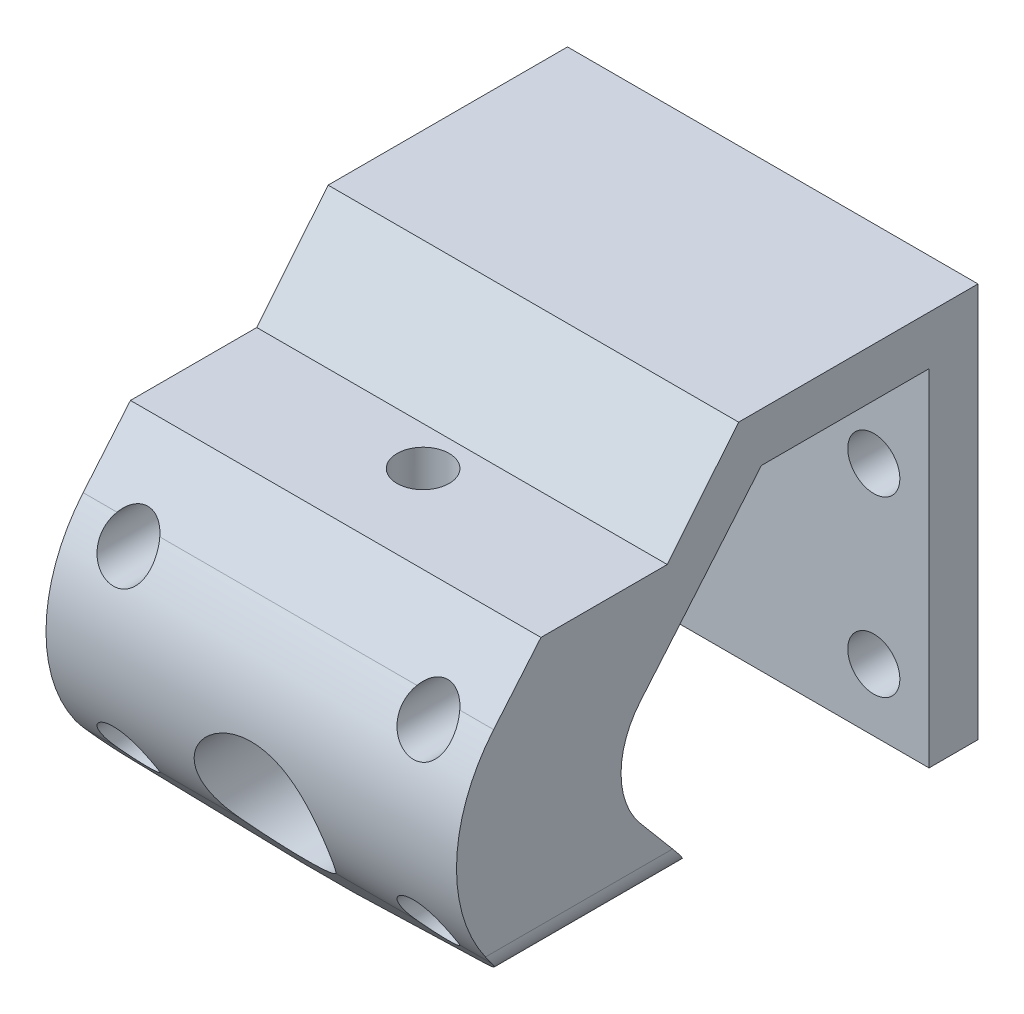
from build123d import *
from OCP.BRepFilletAPI import BRepFilletAPI_MakeChamfer

# Parameters (mm, degrees)
EXTRUDE_1_DEPTH     = 26
SKETCH_2_R          = 1.65
CUT_EXTRUDE_1_DEPTH = 45.819078563
SKETCH_3_W          = 28.1444964
SKETCH_3_H          = 6.1
CUT_EXTRUDE_2_DEPTH = 35.940261345
CUT_EXTRUDE_4_REACH = 46.819
SKETCH_5_R          = 4.1
SKETCH_6_R          = 1.65
CUT_EXTRUDE_5_DEPTH = 41.050210522
CHAMFER_1_SIZE      = 2
CHAMFER_1_SIZE2     = 11.342563639
FILLET_1_R          = 2


with BuildPart() as part:
    # 草图1 → 凸台-拉伸1 (new body)
    with BuildSketch(Plane(origin=(0, 0, 0), x_dir=(0, 0, -1), z_dir=(1, 0, 0))):
        with BuildLine():
            Line((17.407451211, 15.55), (2.245544981, 15.55))
            Line((2.245544981, 15.55), (-2.273793452, 10))
            Line((-2.273793452, 10), (-10.273793452, 10))
            Line((-10.273793452, 10), (-13.270509165, 6.44212097))
            ThreePointArc((-13.270509165, 6.44212097), (-15.622040206, 0), (-13.270509165, -6.44212097))
            Line((-13.270509165, -6.44212097), (-10.273793452, -10))
            Line((-10.273793452, -10), (-2.273793452, -10))
            Line((-2.273793452, -10), (2.245544981, -15.55))
            Line((2.245544981, -15.55), (17.407451211, -15.55))
            Line((17.407451211, -15.55), (17.407451211, 15.55))
        make_face()
        with BuildLine():
            Line((3.687588487, 12.45), (14.307451211, 12.45))
            Line((14.307451211, 12.45), (14.307451211, -12.45))
            Line((14.307451211, -12.45), (3.687588487, -12.45))
            Line((3.687588487, -12.45), (-3.977203858, -3.349902904))
            ThreePointArc((-3.977203858, -3.349902904), (-5.2, 0), (-3.977203858, 3.349902904))
            Line((-3.977203858, 3.349902904), (3.687588487, 12.45))
        make_face(mode=Mode.SUBTRACT)
    extrude(amount=EXTRUDE_1_DEPTH)

    # 草图2 → 切除-拉伸1 (cut, through all)
    with BuildSketch(Plane(origin=(0, 0, -17.407451211), x_dir=(-1, 0, 0), z_dir=(0, 0, -1))):
        with Locations((-22.5, 5.5)):
            Circle(SKETCH_2_R)
        with Locations(Location((-22.5, -5.5, 0), (0, 0, 325.181239638))):
            Circle(SKETCH_2_R)
        with Locations(Location((-3.5, -5.5, 0), (0, 0, 325.181239638))):
            Circle(SKETCH_2_R)
        with Locations(Location((-3.5, 5.5, 0), (0, 0, 180))):
            Circle(SKETCH_2_R)
    extrude(amount=-CUT_EXTRUDE_1_DEPTH, mode=Mode.SUBTRACT)

    # 草图3 → 切除-拉伸2 (cut, through all)
    with BuildSketch(Plane.ZY):
        with Locations((-3.335203011, -12.5)):
            Rectangle(SKETCH_3_W, SKETCH_3_H)
    extrude(amount=-CUT_EXTRUDE_2_DEPTH, mode=Mode.SUBTRACT)

    # 草图5 → 切除-拉伸4 (cut, up to next)
    with BuildSketch(Plane.XY.offset(15.622040206), mode=Mode.PRIVATE) as cut_extrude_4_sk1:
        with Locations(Location((13, -3.65, 0), (0, 0, 4.197484636))):
            Circle(SKETCH_5_R)
    cut_extrude_4_tool1 = extrude(cut_extrude_4_sk1.sketch, amount=-CUT_EXTRUDE_4_REACH, mode=Mode.PRIVATE) & part.part
    add(cut_extrude_4_tool1.solids().sort_by_distance((13, -3.65, 15.62204))[0], mode=Mode.SUBTRACT)

    # 草图6 → 切除-拉伸5 (cut, through all)
    with BuildSketch(Plane.XZ.offset(9.45)):
        with Locations(Location((13, 4.737045189, 0), (0, 0, 270))):
            Circle(SKETCH_6_R)
    extrude(amount=-CUT_EXTRUDE_5_DEPTH, mode=Mode.SUBTRACT)

    # 倒角1: one chamfer whose edges measure the first distance from different faces: ONE call of the kernel's chamfer builder (chamfer() names one face for all edges)
    chamfer_1_edges_1 = [part.edges().sort_by_distance(p)[0] for p in [
        (0, -9.45, 4.78814218),
    ]]
    chamfer_1_side_1 = [part.faces().sort_by_distance(p)[0] for p in [
        (0, -9.035760057, -15.857451211),
    ]]
    chamfer_1_edges_2 = [part.edges().sort_by_distance(p)[0] for p in [
        (26, -9.45, 4.78814218),
    ]]
    chamfer_1_side_2 = [part.faces().sort_by_distance(p)[0] for p in [
        (26, -9.035760057, -15.857451211),
    ]]
    chamfer_1 = BRepFilletAPI_MakeChamfer(part.part.solid().wrapped)
    for e in chamfer_1_edges_1:
        chamfer_1.Add(CHAMFER_1_SIZE, CHAMFER_1_SIZE2, e.wrapped, chamfer_1_side_1[0].wrapped)  # the first distance lies on this face
    for e in chamfer_1_edges_2:
        chamfer_1.Add(CHAMFER_1_SIZE, CHAMFER_1_SIZE2, e.wrapped, chamfer_1_side_2[0].wrapped)  # the first distance lies on this face
    add(Compound.cast(chamfer_1.Shape()), mode=Mode.REPLACE)

    # 圆角1
    # the kernel refuses this fillet: 2 mm, written as the material it takes off along each edge
    with BuildSketch(Plane(origin=(26, -7.45, -3.671707212), x_dir=(-0.9848077530122086, -0.17364817766692747, 0), z_dir=(0, 0, 1))) as fillet_1_piece_1:
        with BuildLine():
            CenterArc((FILLET_1_R * 0.839099631177, -FILLET_1_R), FILLET_1_R, 90, 80)
            Line((-FILLET_1_R * 0.145708121835, -FILLET_1_R * 0.826351822333), (0, 0))
            Line((0, 0), (FILLET_1_R * 0.839099631177, 0))
        make_face()
    extrude(amount=20.288802329, mode=Mode.SUBTRACT)
    with BuildSketch(Plane(origin=(0, -7.45, 16.617095117), x_dir=(0, 1, 0), z_dir=(0, 0, -1))) as fillet_1_piece_2:
        with BuildLine():
            CenterArc((FILLET_1_R * 0.839099631177, FILLET_1_R), FILLET_1_R, 190, 80)
            Line((-FILLET_1_R * 0.145708121835, FILLET_1_R * 0.826351822333), (0, 0))
            Line((0, 0), (FILLET_1_R * 0.839099631177, 0))
        make_face()
    extrude(amount=20.288802329, mode=Mode.SUBTRACT)


solid = part.part
